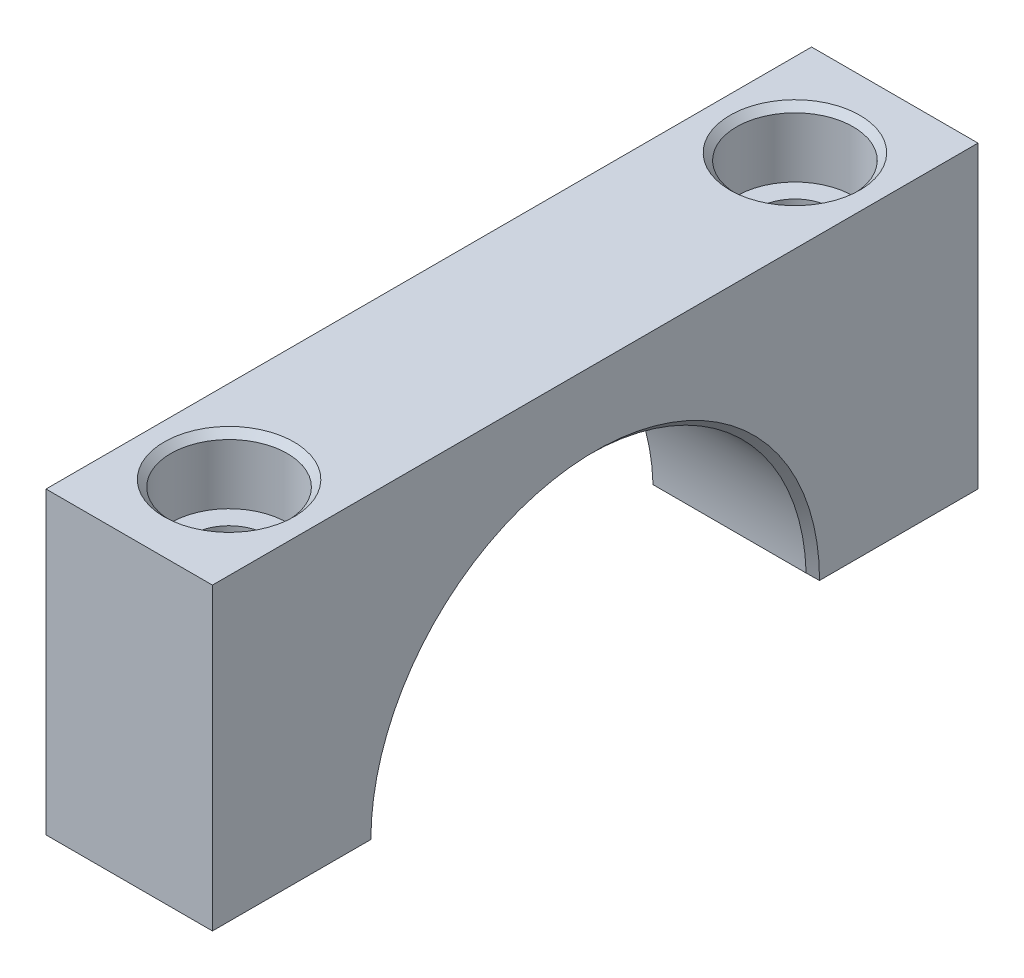
from build123d import *

# Parameters (mm, degrees)
BOSS_EXTRUDE1_DEPTH                           = 15.875
BOSS_EXTRUDE2_DEPTH                           = 15.875
CBORE_FOR_1_4_SOCKET_HEAD_CAP_SCREW1_AT_COUNT = 2
CBORE_FOR_1_4_SOCKET_HEAD_CAP_SCREW1_AT_PITCH = 53.975
MOVE_FACE1_BY                                 = 0.127
MOVE_FACE1_2_BY                               = 0.127
MOVE_START                                    = 28.575
MOVE_FACE2_OUTLINE_W                          = 15.875
MOVE_FACE2_OUTLINE_H                          = 73.025
MOVE_FACE2_OUTLINE_R                          = 5.55625
MOVE_FACE2_DEPTH                              = 6.35
MOVE_START_2                                  = 22.225
MOVE_FACE2_2_OUTLINE_R                        = 5.55625
MOVE_FACE2_2_OUTLINE_R_2                      = 3.57124
MOVE_FACE2_2_DEPTH                            = 6.35


with BuildPart() as part:
    # Sketch1 → Boss-Extrude1 (new body)
    with BuildSketch(Plane(origin=(0, 0, 0), x_dir=(0, 0, -1), z_dir=(1, 0, 0))):
        with BuildLine():
            Line((36.5125, 0), (20.6375, 0))
            ThreePointArc((20.6375, 0), (0, -20.6375), (-20.6375, 0))
            Line((-20.6375, 0), (-36.5125, 0))
            Line((-36.5125, 0), (-36.5125, -34.925))
            Line((-36.5125, -34.925), (36.5125, -34.925))
            Line((36.5125, -34.925), (36.5125, 0))
        make_face()
    extrude(amount=BOSS_EXTRUDE1_DEPTH)


with BuildPart() as body_2:
    # Sketch1<3> → Boss-Extrude2 (new body)
    with BuildSketch(Plane(origin=(0, 0, 0), x_dir=(0, 0, -1), z_dir=(1, 0, 0))):
        with BuildLine():
            ThreePointArc((-20.6375, 0), (0, 20.6375), (20.6375, 0))
            Line((20.6375, 0), (36.5125, 0))
            Line((36.5125, 0), (36.5125, 34.925))
            Line((36.5125, 34.925), (-36.5125, 34.925))
            Line((-36.5125, 34.925), (-36.5125, 0))
            Line((-36.5125, 0), (-20.6375, 0))
        make_face()
    extrude(amount=BOSS_EXTRUDE2_DEPTH)


with BuildPart() as cbore_for_1_4_socket_head_cap_screw1_tool:
    # Sketch4 → CBORE for 1/4 Socket Head Cap Screw1 (revolve)
    with BuildSketch(Plane(origin=(7.9375, 34.925, 26.9875), x_dir=(0, 0, 1), z_dir=(1, 0, 0))):
        Polygon((0, 0), (0, 69.85), (3.57124, 69.85), (3.57124, 6.35), (5.55625, 6.35), (5.55625, 0.635), (6.19125, 0), align=None)
    cbore_for_1_4_socket_head_cap_screw1 = revolve(axis=Axis((7.9375, 41.275, 26.9875), (0, -1, 0)))


with BuildPart() as part_1:
    add(part.part)

    # CBORE for 1/4 Socket Head Cap Screw1: cut by cbore_for_1_4_socket_head_cap_screw1_tool
    add(cbore_for_1_4_socket_head_cap_screw1_tool.part, mode=Mode.SUBTRACT)


with BuildPart() as body_2_1:
    add(body_2.part)

    # CBORE for 1/4 Socket Head Cap Screw1: cut by cbore_for_1_4_socket_head_cap_screw1_tool
    add(cbore_for_1_4_socket_head_cap_screw1_tool.part, mode=Mode.SUBTRACT)


with BuildPart() as cbore_for_1_4_socket_head_cap_screw1_at_tool:
    # CBORE for 1/4 Socket Head Cap Screw1 at: CBORE for 1/4 Socket Head Cap Screw1 ×2
    with Locations(*[(0, 0, -i * CBORE_FOR_1_4_SOCKET_HEAD_CAP_SCREW1_AT_PITCH) for i in range(1, CBORE_FOR_1_4_SOCKET_HEAD_CAP_SCREW1_AT_COUNT)]):
        add(cbore_for_1_4_socket_head_cap_screw1)


with BuildPart() as part_2:
    add(part_1.part)

    # CBORE for 1/4 Socket Head Cap Screw1 at: cut by cbore_for_1_4_socket_head_cap_screw1_at_tool
    add(cbore_for_1_4_socket_head_cap_screw1_at_tool.part, mode=Mode.SUBTRACT)

    # Move Face1 2: a curved face moved inward by 0.127
    add(Solid.thicken(part_2.faces().sort_by_distance((7.9375, -20.6375, 0))[0], -MOVE_FACE1_2_BY), mode=Mode.SUBTRACT)

    # Chamfer1
    # the kernel refuses this chamfer: 0.635 mm, written as the material it takes off along each edge
    with BuildSketch(Plane(origin=(0, 0, 0), x_dir=(0, 0.07868977926472538, -0.9968991516895122), z_dir=(0, 0.9968991516895122, 0.07868977926472538))) as chamfer1_piece_1:
        with BuildLine():
            Line((21.417460512, 0.017960512), (20.746539488, -0.652960512))
            Line((20.746539488, -0.652960512), (20.733839488, -0.652960512))
            ThreePointArc((20.733839488, -0.652960512), (20.7518, -0.326480256), (20.7518, 0))
            Line((20.7518, 0), (20.7645, 0.0127))
            ThreePointArc((20.7645, 0.0127), (21.090980256, 0.0127), (21.417460512, 0.030660512))
            Line((21.417460512, 0.030660512), (21.417460512, 0.017960512))
        make_face()
    revolve(axis=Axis((0, 0, 0), (-1, 0, 0)), revolution_arc=189.026516368, mode=Mode.SUBTRACT)
    with BuildSketch(Plane(origin=(-1.610111621, 0, -20.7645), x_dir=(0, 0, -1), z_dir=(1, 0, 0))) as chamfer1_piece_2:
        with BuildLine():
            Line((0.643801601, 0.017692029), (-0.027368853, -0.633849299))
            Line((-0.027368853, -0.633849299), (-0.040063261, -0.633472445))
            ThreePointArc((-0.040063261, -0.633472445), (-0.015119867, -0.316902726), (-0.0127, 0))
            Line((-0.0127, 0), (0, 0.0127))
            ThreePointArc((0, 0.0127), (0.3219008, 0.0127), (0.643801601, 0.030392029))
            Line((0.643801601, 0.030392029), (0.643801601, 0.017692029))
        make_face()
    extrude(amount=19.095223242, mode=Mode.SUBTRACT)
    with BuildSketch(Plane(origin=(-1.610111621, 0, 20.7645), x_dir=(0, -0.9998899044534173, -0.01483842889716635), z_dir=(1, 0, 0))) as chamfer1_piece_3:
        with BuildLine():
            Line((0.634185626, 0.017960512), (-0.027243086, -0.643468199))
            Line((-0.027243086, -0.643468199), (-0.039941687, -0.643279751))
            ThreePointArc((-0.039941687, -0.643279751), (-0.017475104, -0.321676913), (-0.012698602, 0.000188448))
            Line((-0.012698602, 0.000188448), (0.000188448, 0.012698602))
            ThreePointArc((0.000188448, 0.012698602), (0.317092192, 0.010415864), (0.633997178, 0.030659114))
            Line((0.633997178, 0.030659114), (0.634185626, 0.017960512))
        make_face()
    extrude(amount=19.095223242, mode=Mode.SUBTRACT)
    with BuildSketch(Plane(origin=(15.875, 0, 0), x_dir=(0, 0.0786897792647254, -0.9968991516895122), z_dir=(0, 0.9968991516895122, 0.0786897792647254))) as chamfer1_piece_4:
        with BuildLine():
            Line((20.746539488, 0.652960512), (21.417460512, -0.017960512))
            Line((21.417460512, -0.017960512), (21.417460512, -0.030660512))
            ThreePointArc((21.417460512, -0.030660512), (21.090980256, -0.0127), (20.7645, -0.0127))
            Line((20.7645, -0.0127), (20.7518, 0))
            ThreePointArc((20.7518, 0), (20.7518, 0.326480256), (20.733839488, 0.652960512))
            Line((20.733839488, 0.652960512), (20.746539488, 0.652960512))
        make_face()
    revolve(axis=Axis((15.875, 0, 0), (-1, 0, 0)), revolution_arc=189.026516368, mode=Mode.SUBTRACT)


with BuildPart() as body_2_2:
    add(body_2_1.part)

    # CBORE for 1/4 Socket Head Cap Screw1 at: cut by cbore_for_1_4_socket_head_cap_screw1_at_tool
    add(cbore_for_1_4_socket_head_cap_screw1_at_tool.part, mode=Mode.SUBTRACT)

    # Move Face1: a curved face moved inward by 0.127
    add(Solid.thicken(body_2_2.faces().sort_by_distance((7.9375, 20.6375, 0))[0], -MOVE_FACE1_BY), mode=Mode.SUBTRACT)

    # Move Face2: read off the stored shape, not the designer's step
    # Move Face2 outline → Move Face2 (cut)
    with BuildSketch(Plane(origin=(0, 0, 0), x_dir=(1, 0, 0), z_dir=(0, 1, 0)).offset(MOVE_START)):
        with Locations((7.9375, 0)):
            Rectangle(MOVE_FACE2_OUTLINE_W, MOVE_FACE2_OUTLINE_H)
        with Locations((7.9375, -26.9875)):
            Circle(MOVE_FACE2_OUTLINE_R, mode=Mode.SUBTRACT)
        with Locations((7.9375, 26.9875)):
            Circle(MOVE_FACE2_OUTLINE_R, mode=Mode.SUBTRACT)
    extrude(amount=MOVE_FACE2_DEPTH, mode=Mode.SUBTRACT)

    # Move Face2 2 outline → Move Face2 2 (cut)
    # profile 1 of 2: a face of its own
    with BuildSketch(Plane(origin=(0, 0, 0), x_dir=(1, 0, 0), z_dir=(0, 1, 0)).offset(MOVE_START_2)):
        with Locations((7.9375, 26.9875)):
            Circle(MOVE_FACE2_2_OUTLINE_R)
        with Locations((7.9375, 26.9875)):
            Circle(MOVE_FACE2_2_OUTLINE_R_2, mode=Mode.SUBTRACT)
    # profile 2 of 2: a face of its own
    with BuildSketch(Plane(origin=(0, 0, 0), x_dir=(1, 0, 0), z_dir=(0, 1, 0)).offset(MOVE_START_2)):
        with Locations((7.9375, -26.9875)):
            Circle(MOVE_FACE2_2_OUTLINE_R)
        with Locations((7.9375, -26.9875)):
            Circle(MOVE_FACE2_2_OUTLINE_R_2, mode=Mode.SUBTRACT)
    extrude(amount=MOVE_FACE2_2_DEPTH, mode=Mode.SUBTRACT)

    # Move Face2 3: loft between two sections, ruled curve by curve
    move_face2_3_from = [
        Edge.make_three_point_arc((7.9375, 27.94, -21.43125), (13.49375, 27.94, -26.9875), (7.9375, 27.94, -32.54375)),
        Edge.make_three_point_arc((7.9375, 27.94, -32.54375), (2.38125, 27.94, -26.9875), (7.9375, 27.94, -21.43125)),
    ]
    move_face2_3_to = [
        Edge.make_three_point_arc((7.9375, 28.575, -20.79625), (14.12875, 28.575, -26.9875), (7.9375, 28.575, -33.17875)),
        Edge.make_three_point_arc((7.9375, 28.575, -33.17875), (1.74625, 28.575, -26.9875), (7.9375, 28.575, -20.79625)),
    ]
    move_face2_3 = Solid(Shell([*[Face.make_surface_from_curves(move_face2_3_from[k], move_face2_3_to[k]) for k in range(2)], Face(Wire(move_face2_3_from)), Face(Wire(move_face2_3_to))]))
    add(move_face2_3, mode=Mode.SUBTRACT)

    # Move Face2 4: loft between two sections, ruled curve by curve
    move_face2_4_from = [
        Edge.make_three_point_arc((7.9375, 27.94, 32.54375), (13.49375, 27.94, 26.9875), (7.9375, 27.94, 21.43125)),
        Edge.make_three_point_arc((7.9375, 27.94, 21.43125), (2.38125, 27.94, 26.9875), (7.9375, 27.94, 32.54375)),
    ]
    move_face2_4_to = [
        Edge.make_three_point_arc((7.9375, 28.575, 33.17875), (14.12875, 28.575, 26.9875), (7.9375, 28.575, 20.79625)),
        Edge.make_three_point_arc((7.9375, 28.575, 20.79625), (1.74625, 28.575, 26.9875), (7.9375, 28.575, 33.17875)),
    ]
    move_face2_4 = Solid(Shell([*[Face.make_surface_from_curves(move_face2_4_from[k], move_face2_4_to[k]) for k in range(2)], Face(Wire(move_face2_4_from)), Face(Wire(move_face2_4_to))]))
    add(move_face2_4, mode=Mode.SUBTRACT)

    # Chamfer2
    # the kernel refuses this chamfer: 0.635 mm, written as the material it takes off along each edge
    with BuildSketch(Plane(origin=(0, 0, 0), x_dir=(0, -0.0786897792647251, 0.9968991516895122), z_dir=(0, -0.9968991516895122, -0.0786897792647251))) as chamfer2_piece_1:
        with BuildLine():
            Line((21.417460512, 0.017960512), (20.746539488, -0.652960512))
            Line((20.746539488, -0.652960512), (20.733839488, -0.652960512))
            ThreePointArc((20.733839488, -0.652960512), (20.7518, -0.326480256), (20.7518, 0))
            Line((20.7518, 0), (20.7645, 0.0127))
            ThreePointArc((20.7645, 0.0127), (21.090980256, 0.0127), (21.417460512, 0.030660512))
            Line((21.417460512, 0.030660512), (21.417460512, 0.017960512))
        make_face()
    revolve(axis=Axis((0, 0, 0), (-1, 0, 0)), revolution_arc=189.026516368, mode=Mode.SUBTRACT)
    with BuildSketch(Plane(origin=(-1.610111621, 0, 20.7645), x_dir=(0, 0, 1), z_dir=(1, 0, 0))) as chamfer2_piece_2:
        with BuildLine():
            Line((0.643801601, 0.017692029), (-0.027368853, -0.633849299))
            Line((-0.027368853, -0.633849299), (-0.040063261, -0.633472445))
            ThreePointArc((-0.040063261, -0.633472445), (-0.015119867, -0.316902726), (-0.0127, 0))
            Line((-0.0127, 0), (0, 0.0127))
            ThreePointArc((0, 0.0127), (0.3219008, 0.0127), (0.643801601, 0.030392029))
            Line((0.643801601, 0.030392029), (0.643801601, 0.017692029))
        make_face()
    extrude(amount=19.095223242, mode=Mode.SUBTRACT)
    with BuildSketch(Plane(origin=(-1.610111621, 0, -20.7645), x_dir=(0, 0.9998899044534173, 0.014838428897166573), z_dir=(1, 0, 0))) as chamfer2_piece_3:
        with BuildLine():
            Line((0.634185626, 0.017960512), (-0.027243086, -0.643468199))
            Line((-0.027243086, -0.643468199), (-0.039941687, -0.643279751))
            ThreePointArc((-0.039941687, -0.643279751), (-0.017475104, -0.321676913), (-0.012698602, 0.000188448))
            Line((-0.012698602, 0.000188448), (0.000188448, 0.012698602))
            ThreePointArc((0.000188448, 0.012698602), (0.317092192, 0.010415864), (0.633997178, 0.030659114))
            Line((0.633997178, 0.030659114), (0.634185626, 0.017960512))
        make_face()
    extrude(amount=19.095223242, mode=Mode.SUBTRACT)
    with BuildSketch(Plane(origin=(15.875, 0, 0), x_dir=(0, -0.07868977926472513, 0.9968991516895122), z_dir=(0, -0.9968991516895122, -0.07868977926472513))) as chamfer2_piece_4:
        with BuildLine():
            Line((20.746539488, 0.652960512), (21.417460512, -0.017960512))
            Line((21.417460512, -0.017960512), (21.417460512, -0.030660512))
            ThreePointArc((21.417460512, -0.030660512), (21.090980256, -0.0127), (20.7645, -0.0127))
            Line((20.7645, -0.0127), (20.7518, 0))
            ThreePointArc((20.7518, 0), (20.7518, 0.326480256), (20.733839488, 0.652960512))
            Line((20.733839488, 0.652960512), (20.746539488, 0.652960512))
        make_face()
    revolve(axis=Axis((15.875, 0, 0), (-1, 0, 0)), revolution_arc=189.026516368, mode=Mode.SUBTRACT)


solid = body_2_2.part
